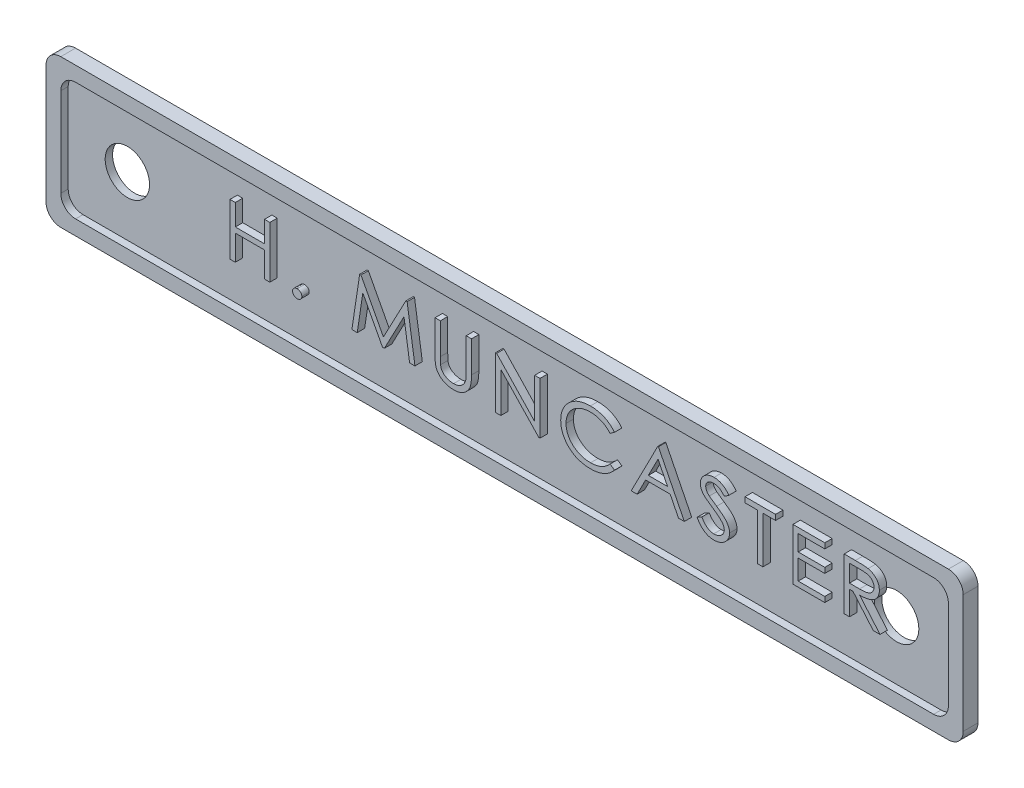
from build123d import *

# Parameters (mm, degrees)
BOSS_EXTRUDE1_DEPTH     = 1
CUT_EXTRUDE1_DEPTH      = 32.416556145
CUT_EXTRUDE1_DEPTH_BACK = 0.5
CUT_EXTRUDE2_DEPTH      = 32.416556145
CUT_EXTRUDE2_DEPTH_BACK = 32.416556145
SKETCH3_R               = 1.5
BOSS_EXTRUDE2_DEPTH     = 0.5


# Read off the part's stored shape, not the designer's step: Boss-Extrude2
with BuildPart() as part:
    # Sketch1 → Boss-Extrude1 (new body)
    with BuildSketch(Plane.XY):
        with BuildLine():
            Line((-30, -5), (30, -5))
            ThreePointArc((30, -5), (30.707106781, -4.707106781), (31, -4))
            Line((31, -4), (31, 4))
            ThreePointArc((31, 4), (30.707106781, 4.707106781), (30, 5))
            Line((30, 5), (-30, 5))
            ThreePointArc((-30, 5), (-30.707106781, 4.707106781), (-31, 4))
            Line((-31, 4), (-31, -4))
            ThreePointArc((-31, -4), (-30.707106781, -4.707106781), (-30, -5))
        make_face()
    extrude(amount=-BOSS_EXTRUDE1_DEPTH)

    # Sketch2 → Cut-Extrude1 (cut, two sides: drawn at the far end of the back side and taken through both)
    with BuildSketch(Plane.XY.offset(-CUT_EXTRUDE1_DEPTH_BACK)):
        with BuildLine():
            Line((-29, 4), (29, 4))
            ThreePointArc((29, 4), (29.707106781, 3.707106781), (30, 3))
            Line((30, 3), (30, -3))
            ThreePointArc((30, -3), (29.707106781, -3.707106781), (29, -4))
            Line((29, -4), (-29, -4))
            ThreePointArc((-29, -4), (-29.707106781, -3.707106781), (-30, -3))
            Line((-30, -3), (-30, 3))
            ThreePointArc((-30, 3), (-29.707106781, 3.707106781), (-29, 4))
        make_face()
    extrude(amount=CUT_EXTRUDE1_DEPTH + CUT_EXTRUDE1_DEPTH_BACK, mode=Mode.SUBTRACT)

    # Sketch3 → Cut-Extrude2 (cut, two sides: drawn at the far end of the back side and taken through both)
    with BuildSketch(Plane.XY.offset(-CUT_EXTRUDE2_DEPTH_BACK)):
        with Locations((-26, 0)):
            Circle(SKETCH3_R)
        with Locations((26, 0)):
            Circle(SKETCH3_R)
    extrude(amount=CUT_EXTRUDE2_DEPTH + CUT_EXTRUDE2_DEPTH_BACK, mode=Mode.SUBTRACT)

    # Boss-Extrude2 outline → Boss-Extrude2 (add)
    # profile 1 of 11: a face of its own
    with BuildSketch(Plane.XY.offset(-0.5)):
        with BuildLine():
            add(Edge.make_bspline(
                [(25.331789326, 1.42604884), (25.33144577, 1.402426709), (25.330767279, 1.355775232), (25.323553479, 1.286869141), (25.311696069, 1.220342524), (25.295212367, 1.156025841), (25.275565465, 1.093459874), (25.248777369, 1.033708049), (25.219053836, 0.975596543), (25.172971726, 0.901335826), (25.104081894, 0.815663446), (25.005342026, 0.725416168), (24.890178633, 0.649457557), (24.782551932, 0.597584892), (24.687441161, 0.563920272), (24.608977068, 0.54043691), (24.523526029, 0.5220622), (24.431893003, 0.505802679), (24.333607357, 0.493375206), (24.228826773, 0.484354701), (24.117507422, 0.478714503), (24.041030877, 0.477866492), (24.001761281, 0.477431051)],
                knots=[0, 0, 0, 0, 0.038286397, 0.075612016, 0.112179893, 0.147744628, 0.183212346, 0.218338395, 0.253757505, 0.288981512, 0.35987342, 0.431214511, 0.504987446, 0.582774945, 0.624243966, 0.668485211, 0.715460403, 0.765856342, 0.819339851, 0.876011339, 0.936333622, 1, 1, 1, 1], degree=3))
            add(Edge.make_bspline(
                [(24.568968813, 2.314370154), (24.596674275, 2.30806279), (24.651273963, 2.295632746), (24.730040668, 2.269073048), (24.80511746, 2.238433638), (24.876409994, 2.202733394), (24.943149357, 2.160919698), (25.006368689, 2.114740718), (25.065737568, 2.063390816), (25.119822707, 2.006595013), (25.170155663, 1.94652931), (25.213390147, 1.882036331), (25.250327495, 1.814324863), (25.27973483, 1.742983969), (25.302790942, 1.66856425), (25.319932563, 1.59076033), (25.329621406, 1.509494837), (25.331060083, 1.454118319), (25.331789326, 1.42604884)],
                knots=[0, 0, 0, 0, 0.066872612, 0.131787147, 0.195458011, 0.257726808, 0.319271524, 0.380693086, 0.441939345, 0.50382514, 0.565199839, 0.626255411, 0.686340912, 0.746539722, 0.807637445, 0.869599052, 0.933901825, 1, 1, 1, 1], degree=3))
            add(Edge.make_bspline(
                [(23.710795736, 2.362046436), (23.761509924, 2.361891951), (23.858736382, 2.361595782), (23.998057394, 2.359919705), (24.124468825, 2.355162204), (24.238129814, 2.351043281), (24.339051146, 2.343516076), (24.427289451, 2.336492171), (24.502649927, 2.326927211), (24.548201091, 2.318302389), (24.568968813, 2.314370154)],
                knots=[0, 0, 0, 0, 0.176792471, 0.338936828, 0.485664851, 0.617769923, 0.735369726, 0.838412773, 0.926329025, 1, 1, 1, 1], degree=3))
            Line((23.710795736, 2.362046436), (22.953584198, 2.362046436))
            Line((22.953584198, 2.362046436), (22.953584198, -1.137953564))
            Line((22.953584198, -1.137953564), (23.312558557, -1.137953564))
            Line((23.312558557, -1.137953564), (23.312558557, 0.477431051))
            Line((23.312558557, 0.477431051), (23.545330993, 0.477431051))
            Line((23.545330993, 0.477431051), (24.920230833, -1.137953564))
            Line((24.920230833, -1.137953564), (25.376661121, -1.137953564))
            Line((25.376661121, -1.137953564), (24.001761281, 0.477431051))
        make_face()
        with BuildLine():
            add(Edge.make_bspline(
                [(23.989842211, 0.831497558), (24.02163156, 0.831483625), (24.083128745, 0.831456672), (24.171938527, 0.835436582), (24.25449268, 0.840017294), (24.330510081, 0.846909076), (24.400226371, 0.855943476), (24.463428912, 0.867037126), (24.520362266, 0.880202185), (24.586747928, 0.900289751), (24.660927982, 0.932218463), (24.741538379, 0.978635524), (24.810065279, 1.037437383), (24.86873104, 1.103905839), (24.914761041, 1.178055018), (24.948218385, 1.257264055), (24.96962039, 1.340554612), (24.971744851, 1.39787634), (24.972814967, 1.426749961)],
                knots=[0, 0, 0, 0, 0.073424095, 0.142040506, 0.205318064, 0.264410853, 0.318316658, 0.367666659, 0.412582936, 0.453227538, 0.527731342, 0.598653703, 0.667225499, 0.735330284, 0.802742541, 0.867818528, 0.933418655, 1, 1, 1, 1], degree=3))
            Line((23.989842211, 0.831497558), (23.312558557, 0.83640541))
            Line((23.312558557, 0.83640541), (23.312558557, 2.003072077))
            Line((23.312558557, 2.003072077), (24.005968012, 2.003072077))
            add(Edge.make_bspline(
                [(24.972814967, 1.426749961), (24.971370651, 1.454902425), (24.968506682, 1.510726595), (24.948430464, 1.592493569), (24.914170068, 1.669870833), (24.866727295, 1.741582204), (24.810031622, 1.807676), (24.742411848, 1.863149596), (24.667394952, 1.909440523), (24.597654287, 1.938847474), (24.535265677, 1.957222935), (24.480948809, 1.969625267), (24.419396819, 1.980162942), (24.350557273, 1.988184941), (24.274599171, 1.995292544), (24.191349943, 2.000055009), (24.101107106, 2.002863026), (24.038455551, 2.003000691), (24.005968012, 2.003072077)],
                knots=[0, 0, 0, 0, 0.066371867, 0.131610311, 0.197257284, 0.264983957, 0.333739042, 0.40184148, 0.470377491, 0.541015671, 0.579555523, 0.623678142, 0.672339053, 0.726758959, 0.787090798, 0.852245365, 0.923382836, 1, 1, 1, 1], degree=3))
        make_face(mode=Mode.SUBTRACT)
    # profile 2 of 11: a face of its own
    with BuildSketch(Plane.XY.offset(-0.5)):
        with BuildLine():
            add(Edge.make_bspline(
                [(14.143708397, -1.227697154), (14.115403602, -1.227203282), (14.059601152, -1.226229622), (13.977002615, -1.217127876), (13.89620805, -1.204490854), (13.817683654, -1.184317858), (13.740762519, -1.159838533), (13.665864432, -1.12989167), (13.593209588, -1.093599389), (13.522150859, -1.052390006), (13.452761098, -1.004087581), (13.385002283, -0.948812861), (13.318719817, -0.885970096), (13.254475201, -0.815407337), (13.19039256, -0.738289713), (13.128247367, -0.653464045), (13.067719476, -0.561067958), (13.029582909, -0.496128671), (13.009994454, -0.462773276)],
                knots=[0, 0, 0, 0, 0.058847856, 0.116017606, 0.172674649, 0.228791152, 0.284438335, 0.340491645, 0.396359181, 0.453216044, 0.511196287, 0.572004925, 0.634927463, 0.700977186, 0.770371014, 0.843383461, 0.919555531, 1, 1, 1, 1], degree=3))
            add(Edge.make_bspline(
                [(15.208712403, -0.280481609), (15.207807786, -0.311862478), (15.206015389, -0.37404014), (15.190539439, -0.465390526), (15.167093736, -0.554082644), (15.13197973, -0.639061407), (15.088608944, -0.721589531), (15.034825327, -0.800464366), (14.971084763, -0.875776161), (14.898965391, -0.946987439), (14.820207349, -1.012857307), (14.736070168, -1.070223869), (14.647798082, -1.119359077), (14.554940755, -1.158254846), (14.458121233, -1.189526896), (14.35720182, -1.211759523), (14.251831986, -1.225574186), (14.180210112, -1.226980456), (14.143708397, -1.227697154)],
                knots=[0, 0, 0, 0, 0.059474724, 0.117842472, 0.17526004, 0.233122401, 0.291812385, 0.351805112, 0.413777488, 0.478655314, 0.543805102, 0.608225581, 0.671510741, 0.735065405, 0.798843786, 0.864226857, 0.930803926, 1, 1, 1, 1], degree=3))
            add(Edge.make_bspline(
                [(14.335114647, 0.849025602), (14.375477316, 0.82144876), (14.453396585, 0.768212255), (14.563842546, 0.68711917), (14.664916203, 0.608930282), (14.755934236, 0.532729617), (14.837124664, 0.459051804), (14.9080745, 0.387271354), (14.970260913, 0.318434862), (15.021859956, 0.250193252), (15.06582341, 0.183501101), (15.103872969, 0.117524179), (15.136236588, 0.051481161), (15.163120224, -0.014448866), (15.18386449, -0.080786909), (15.197213161, -0.147362151), (15.207367785, -0.213802189), (15.208263899, -0.258240361), (15.208712403, -0.280481609)],
                knots=[0, 0, 0, 0, 0.098626432, 0.190396213, 0.276420438, 0.356418976, 0.429850913, 0.497539495, 0.560000044, 0.616870403, 0.669969696, 0.721089008, 0.770437721, 0.818248483, 0.864635824, 0.910415192, 0.955162918, 1, 1, 1, 1], degree=3))
            add(Edge.make_bspline(
                [(13.837318172, 1.197483135), (13.845442595, 1.190636517), (13.864792261, 1.174330156), (13.900118502, 1.1479888), (13.946268003, 1.114718871), (14.003144942, 1.074636462), (14.070634785, 1.027243914), (14.149358241, 0.974351786), (14.238426009, 0.91374824), (14.301664365, 0.871416966), (14.335114647, 0.849025602)],
                knots=[0, 0, 0, 0, 0.05242958, 0.124869786, 0.217393222, 0.333247949, 0.468284315, 0.624409857, 0.801329493, 1, 1, 1, 1], degree=3))
            add(Edge.make_bspline(
                [(13.593327788, 1.649706692), (13.594047127, 1.630966394), (13.595486478, 1.593468305), (13.605786614, 1.537749049), (13.621837069, 1.482600532), (13.645525964, 1.42772144), (13.677682614, 1.371815843), (13.72124318, 1.315280933), (13.774912437, 1.256181157), (13.815760638, 1.217759871), (13.837318172, 1.197483135)],
                knots=[0, 0, 0, 0, 0.105914595, 0.211928052, 0.319381041, 0.430075511, 0.549063436, 0.68304901, 0.832729921, 1, 1, 1, 1], degree=3))
            add(Edge.make_bspline(
                [(14.135294935, 2.092815667), (14.0970436, 2.091610002), (14.023411819, 2.089289162), (13.91886913, 2.063845258), (13.824851488, 2.023848373), (13.756711755, 1.976303887), (13.709002563, 1.932918563), (13.678613472, 1.897657801), (13.651425658, 1.861735009), (13.63065402, 1.822411743), (13.613258275, 1.782045522), (13.60271647, 1.739106157), (13.594066594, 1.695156236), (13.593575473, 1.664943657), (13.593327788, 1.649706692)],
                knots=[0, 0, 0, 0, 0.146686048, 0.282362824, 0.410636052, 0.537156407, 0.599427582, 0.657961687, 0.715789117, 0.772040649, 0.828399565, 0.884154463, 0.94157618, 1, 1, 1, 1], degree=3))
            add(Edge.make_bspline(
                [(14.856749262, 1.688969513), (14.838605851, 1.708680114), (14.803449185, 1.746873542), (14.751108622, 1.800922103), (14.700343244, 1.849275788), (14.65229842, 1.893255365), (14.605108071, 1.93059437), (14.561135802, 1.964359681), (14.518290634, 1.991306503), (14.465112643, 2.021658418), (14.397338223, 2.050177609), (14.313180358, 2.07499781), (14.225342047, 2.090035284), (14.165500652, 2.091883005), (14.135294935, 2.092815667)],
                knots=[0, 0, 0, 0, 0.09387455, 0.181901644, 0.263569768, 0.339536882, 0.410008252, 0.474376863, 0.533669217, 0.587201607, 0.688819045, 0.790400177, 0.894201782, 1, 1, 1, 1], degree=3))
            Line((14.856749262, 1.688969513), (15.163840608, 1.904213904))
            add(Edge.make_bspline(
                [(14.161236442, 2.451790026), (14.205507298, 2.450580815), (14.293463654, 2.448178383), (14.422582099, 2.424729007), (14.547535633, 2.388132094), (14.647939446, 2.34516266), (14.727081589, 2.302784571), (14.786948305, 2.263562484), (14.847726748, 2.21848468), (14.910265893, 2.168338854), (14.972662761, 2.11109282), (15.035774179, 2.047674626), (15.100168121, 1.978523714), (15.142280893, 1.929375451), (15.163840608, 1.904213904)],
                knots=[0, 0, 0, 0, 0.111965164, 0.222449906, 0.331017474, 0.441010147, 0.498185751, 0.558078741, 0.621972206, 0.689694644, 0.760886176, 0.836182118, 0.91613312, 1, 1, 1, 1], degree=3))
            add(Edge.make_bspline(
                [(13.234353429, 1.634983135), (13.235858925, 1.672021896), (13.238840919, 1.745386029), (13.261952609, 1.852653208), (13.299528808, 1.954813354), (13.351434669, 2.051120841), (13.417832506, 2.139662799), (13.496421151, 2.219240774), (13.587968506, 2.287895057), (13.689657185, 2.346368512), (13.800260806, 2.39280488), (13.916179408, 2.427811972), (14.03740464, 2.447479384), (14.119569379, 2.450339576), (14.161236442, 2.451790026)],
                knots=[0, 0, 0, 0, 0.080663004, 0.159772388, 0.237920175, 0.317221133, 0.397282184, 0.478310936, 0.560104337, 0.645889526, 0.733293687, 0.820954168, 0.909202976, 1, 1, 1, 1], degree=3))
            add(Edge.make_bspline(
                [(13.441184358, 1.10213057), (13.424737862, 1.122693339), (13.392494444, 1.163006724), (13.350348436, 1.226565114), (13.313868239, 1.291148051), (13.285915358, 1.357889794), (13.261759356, 1.424961708), (13.245820704, 1.493899943), (13.236734325, 1.564159388), (13.2351478, 1.611353236), (13.234353429, 1.634983135)],
                knots=[0, 0, 0, 0, 0.135250219, 0.26515856, 0.391492433, 0.51575998, 0.636542915, 0.757439247, 0.878550146, 1, 1, 1, 1], degree=3))
            add(Edge.make_bspline(
                [(14.048355833, 0.626068872), (14.009417676, 0.652272653), (13.935022529, 0.702337532), (13.830941851, 0.777093355), (13.737347972, 0.844577954), (13.655869573, 0.907437846), (13.585273972, 0.963454061), (13.526366602, 1.014230663), (13.47921031, 1.059350744), (13.452948206, 1.088896046), (13.441184358, 1.10213057)],
                knots=[0, 0, 0, 0, 0.182070466, 0.347863382, 0.497115649, 0.629679678, 0.747065389, 0.846688458, 0.931325621, 1, 1, 1, 1], degree=3))
            add(Edge.make_bspline(
                [(14.717226025, 0.067975923), (14.700637452, 0.08805014), (14.665721953, 0.130302193), (14.605576168, 0.192642853), (14.535743992, 0.257757762), (14.456890311, 0.326292011), (14.36792156, 0.396882022), (14.270549237, 0.471441062), (14.163173089, 0.548516228), (14.087516702, 0.599617892), (14.048355833, 0.626068872)],
                knots=[0, 0, 0, 0, 0.089345299, 0.188053285, 0.29699683, 0.416964832, 0.546483428, 0.686686869, 0.837824474, 1, 1, 1, 1], degree=3))
            add(Edge.make_bspline(
                [(14.849738044, -0.275573756), (14.848005388, -0.246432946), (14.844480749, -0.187153548), (14.818709536, -0.099447667), (14.776444721, -0.012874089), (14.737524146, 0.040263334), (14.717226025, 0.067975923)],
                knots=[0, 0, 0, 0, 0.232957253, 0.473890927, 0.725620037, 1, 1, 1, 1], degree=3))
            add(Edge.make_bspline(
                [(14.13319157, -0.868722795), (14.165276301, -0.867862919), (14.228891106, -0.866158032), (14.322431799, -0.849992631), (14.413109161, -0.8248983), (14.499226144, -0.789100994), (14.579705142, -0.745690842), (14.650777381, -0.693851979), (14.71146759, -0.634817444), (14.761272424, -0.569450625), (14.800531782, -0.499481438), (14.828760177, -0.426794768), (14.846620155, -0.351919525), (14.848693698, -0.301145984), (14.849738044, -0.275573756)],
                knots=[0, 0, 0, 0, 0.093111179, 0.184612719, 0.274864592, 0.365871363, 0.454874139, 0.539859979, 0.620498054, 0.699915665, 0.777709765, 0.852708708, 0.925816355, 1, 1, 1, 1], degree=3))
            add(Edge.make_bspline(
                [(13.330407115, -0.285389462), (13.358993154, -0.331548446), (13.413982827, -0.420342396), (13.507054139, -0.538991213), (13.602366732, -0.640267345), (13.701069454, -0.723837643), (13.8040504, -0.788349386), (13.910494455, -0.834747739), (14.02067023, -0.863533282), (14.095630164, -0.866990453), (14.13319157, -0.868722795)],
                knots=[0, 0, 0, 0, 0.156627694, 0.301297613, 0.434433764, 0.557523125, 0.673586178, 0.783874365, 0.891702377, 1, 1, 1, 1], degree=3))
            Line((13.330407115, -0.285389462), (13.009994454, -0.462773276))
        make_face()
    # profile 3 of 11: a face of its own
    with BuildSketch(Plane.XY.offset(-0.5)):
        with BuildLine():
            add(Edge.make_bspline(
                [(5.799938365, 2.451790026), (5.842722913, 2.451310074), (5.927457029, 2.450359537), (6.053135577, 2.440989804), (6.175726748, 2.425582898), (6.295055606, 2.404498406), (6.411370468, 2.378188385), (6.524019961, 2.344239611), (6.633751233, 2.304860566), (6.740196418, 2.260296534), (6.842536172, 2.20957993), (6.940819703, 2.154437267), (7.033970061, 2.093884565), (7.123005604, 2.029493009), (7.206123027, 1.959108665), (7.285272032, 1.884468716), (7.35952587, 1.80482672), (7.405142271, 1.748148775), (7.427943172, 1.719818872)],
                knots=[0, 0, 0, 0, 0.069378727, 0.137403465, 0.204255485, 0.269685896, 0.333862656, 0.39754052, 0.460363228, 0.522874159, 0.584575479, 0.645504776, 0.705536189, 0.764669447, 0.823584865, 0.882033913, 0.941035833, 1, 1, 1, 1], degree=3))
            add(Edge.make_bspline(
                [(3.793327788, 0.632378968), (3.795084712, 0.695339076), (3.798542909, 0.819265034), (3.825725917, 1.001242739), (3.870757804, 1.175317467), (3.933245515, 1.342019845), (4.014880532, 1.500529584), (4.113099598, 1.652151758), (4.230938385, 1.794818206), (4.363901615, 1.92943771), (4.510661238, 2.051727213), (4.667829367, 2.159521768), (4.834992486, 2.248943027), (5.010178277, 2.324075972), (5.194875891, 2.381621249), (5.388608737, 2.421852652), (5.591275879, 2.447054225), (5.729517682, 2.450191759), (5.799938365, 2.451790026)],
                knots=[0, 0, 0, 0, 0.062456062, 0.122933832, 0.182106742, 0.240599535, 0.299199345, 0.358698555, 0.419511983, 0.48248259, 0.5462033, 0.608789684, 0.671255649, 0.734015374, 0.797681622, 0.862859328, 0.930140236, 1, 1, 1, 1], degree=3))
            add(Edge.make_bspline(
                [(4.265883877, -0.615617827), (4.228054082, -0.572160181), (4.153123068, -0.486081857), (4.057453218, -0.345501026), (3.975062129, -0.199267793), (3.909453581, -0.045443622), (3.857017217, 0.114437236), (3.819950914, 0.281122908), (3.797944078, 0.454638412), (3.794883328, 0.572486161), (3.793327788, 0.632378968)],
                knots=[0, 0, 0, 0, 0.126375425, 0.250316938, 0.372494108, 0.494282934, 0.61676667, 0.741352018, 0.868549432, 1, 1, 1, 1], degree=3))
            add(Edge.make_bspline(
                [(5.805547339, -1.227697154), (5.765333722, -1.227439466), (5.685996831, -1.226931076), (5.568858076, -1.218515643), (5.454868185, -1.20707338), (5.344088059, -1.189814121), (5.236185183, -1.169577952), (5.132091575, -1.142214037), (5.030851271, -1.111661147), (4.932743545, -1.075928451), (4.837911207, -1.0352594), (4.746454245, -0.989467166), (4.658282259, -0.939033331), (4.57302635, -0.884130085), (4.490952157, -0.824621769), (4.412340996, -0.759950524), (4.336966663, -0.690398331), (4.289686941, -0.640659123), (4.265883877, -0.615617827)],
                knots=[0, 0, 0, 0, 0.070622674, 0.139330502, 0.206202275, 0.271810776, 0.336221533, 0.39895142, 0.46076652, 0.521936161, 0.582256799, 0.641925698, 0.701502727, 0.760604013, 0.819974173, 0.879477605, 0.939322778, 1, 1, 1, 1], degree=3))
            add(Edge.make_bspline(
                [(7.427943172, -0.493622635), (7.404449926, -0.522202897), (7.357434839, -0.579398206), (7.281020182, -0.659415373), (7.200822448, -0.735174511), (7.115564218, -0.805022367), (7.026867745, -0.871236505), (6.933169606, -0.931468862), (6.835579555, -0.986967336), (6.734025382, -1.037364774), (6.62882661, -1.082473185), (6.51999147, -1.120755463), (6.408366908, -1.153749075), (6.29377569, -1.181328726), (6.175997927, -1.20229148), (6.055190584, -1.216675861), (5.931439627, -1.226343456), (5.847867109, -1.227242097), (5.805547339, -1.227697154)],
                knots=[0, 0, 0, 0, 0.060159729, 0.120392676, 0.179827417, 0.239499956, 0.299563525, 0.359771276, 0.420548767, 0.482090621, 0.544085172, 0.606606614, 0.669634497, 0.733346495, 0.798220522, 0.864090401, 0.931177578, 1, 1, 1, 1], degree=3))
            Line((7.427943172, -0.493622635), (7.129966409, -0.285389462))
            add(Edge.make_bspline(
                [(5.811156313, -0.868722795), (5.875525403, -0.867029298), (6.002289781, -0.863694234), (6.188187352, -0.835603015), (6.366154734, -0.79008616), (6.536132183, -0.725850279), (6.69823858, -0.643494047), (6.851734141, -0.542344284), (6.997508677, -0.42343408), (7.085310823, -0.331928559), (7.129966409, -0.285389462)],
                knots=[0, 0, 0, 0, 0.129799545, 0.255618941, 0.378318524, 0.49977355, 0.621436125, 0.744356528, 0.869981436, 1, 1, 1, 1], degree=3))
            add(Edge.make_bspline(
                [(4.152302147, 0.608540827), (4.153449201, 0.556796173), (4.155702798, 0.455134411), (4.179431474, 0.30631858), (4.215035688, 0.163722496), (4.268067524, 0.028272175), (4.333774519, -0.101393372), (4.415267766, -0.224336589), (4.511843023, -0.340008006), (4.621569835, -0.448164556), (4.742365975, -0.546670024), (4.872059304, -0.633154375), (5.010119535, -0.705828044), (5.155441689, -0.765419497), (5.308489959, -0.811981395), (5.469322737, -0.844437937), (5.637646089, -0.865641743), (5.752663614, -0.86768413), (5.811156313, -0.868722795)],
                knots=[0, 0, 0, 0, 0.062485776, 0.122764647, 0.181680112, 0.239799385, 0.298159751, 0.357070476, 0.417645744, 0.47996084, 0.542998926, 0.605747799, 0.668037285, 0.731242206, 0.795306543, 0.861059661, 0.929341242, 1, 1, 1, 1], degree=3))
            add(Edge.make_bspline(
                [(5.788019294, 2.092815667), (5.750834636, 2.092412775), (5.677031881, 2.09161313), (5.567765237, 2.081079628), (5.460508121, 2.065897665), (5.355335463, 2.044209093), (5.252245159, 2.015851547), (5.150764231, 1.982595946), (5.052082999, 1.941399019), (4.955417671, 1.895519804), (4.862760027, 1.84386908), (4.77488877, 1.787768129), (4.692627927, 1.72740513), (4.61592158, 1.662610737), (4.544354433, 1.593690599), (4.477190262, 1.521081391), (4.417395259, 1.442645747), (4.361597388, 1.361667096), (4.312624686, 1.276678857), (4.269961286, 1.188989432), (4.232858148, 1.098826855), (4.203927966, 1.005525098), (4.180396629, 0.910074383), (4.164504803, 0.811821827), (4.154428466, 0.711115337), (4.153014806, 0.64291979), (4.152302147, 0.608540827)],
                knots=[0, 0, 0, 0, 0.045279497, 0.089869096, 0.133592367, 0.177197774, 0.220568361, 0.263780755, 0.307184966, 0.350733648, 0.394063104, 0.436312942, 0.477651363, 0.518257898, 0.55852672, 0.598627135, 0.638602046, 0.678556678, 0.718352774, 0.75794981, 0.797281925, 0.836988313, 0.876829189, 0.916938697, 0.958126863, 1, 1, 1, 1], degree=3))
            add(Edge.make_bspline(
                [(7.129966409, 1.509482333), (7.109444113, 1.532876091), (7.068537208, 1.579506655), (7.002359604, 1.644717318), (6.932934536, 1.705341383), (6.861446064, 1.762775635), (6.785999109, 1.814620072), (6.707501264, 1.862226248), (6.62605059, 1.905766498), (6.541772444, 1.945033517), (6.455021978, 1.980121901), (6.366029001, 2.010199772), (6.274935318, 2.035477822), (6.181868315, 2.056663623), (6.086302586, 2.072512455), (5.988792582, 2.08459988), (5.889090049, 2.09176941), (5.8219183, 2.092464753), (5.788019294, 2.092815667)],
                knots=[0, 0, 0, 0, 0.061749288, 0.123084294, 0.184217265, 0.244633342, 0.304978153, 0.365754619, 0.426764285, 0.488188676, 0.550205677, 0.612399361, 0.674522085, 0.737763796, 0.801742866, 0.866698135, 0.932727661, 1, 1, 1, 1], degree=3))
            Line((7.129966409, 1.509482333), (7.427943172, 1.719818872))
        make_face()
    # profile 4 of 11: a face of its own
    with BuildSketch(Plane.XY.offset(-0.5)):
        with BuildLine():
            add(Edge.make_bspline(
                [(-4.636680225, -0.489415904), (-4.642342999, -0.470793544), (-4.654610192, -0.430452171), (-4.667903337, -0.363519843), (-4.679944277, -0.286600281), (-4.688415771, -0.199237294), (-4.69626794, -0.102025322), (-4.701924428, 0.005516333), (-4.704259353, 0.123354467), (-4.705002664, 0.205395351), (-4.705390161, 0.248164224)],
                knots=[0, 0, 0, 0, 0.078528093, 0.17011438, 0.275118877, 0.392739949, 0.524280677, 0.668816025, 0.827349915, 1, 1, 1, 1], degree=3))
            add(Edge.make_bspline(
                [(-3.433555225, -1.227697154), (-3.470494244, -1.226906647), (-3.543081423, -1.225353257), (-3.649978897, -1.216597913), (-3.752619993, -1.199896111), (-3.851771301, -1.178896367), (-3.946377028, -1.149550441), (-4.03750394, -1.115713618), (-4.123735661, -1.073628472), (-4.206405072, -1.027272134), (-4.283227927, -0.974804577), (-4.35373448, -0.917743432), (-4.417832694, -0.856596747), (-4.475303535, -0.791399553), (-4.526578474, -0.72229163), (-4.56958, -0.648317592), (-4.607497776, -0.570938194), (-4.62690119, -0.516734013), (-4.636680225, -0.489415904)],
                knots=[0, 0, 0, 0, 0.073340365, 0.144117799, 0.212689457, 0.279668405, 0.345126088, 0.40914745, 0.472438429, 0.535393527, 0.597161272, 0.656866437, 0.715275907, 0.772799756, 0.829218492, 0.885791531, 0.942440614, 1, 1, 1, 1], degree=3))
            add(Edge.make_bspline(
                [(-2.237441443, 0.248164224), (-2.237627754, 0.210063262), (-2.237991398, 0.135697125), (-2.243235865, 0.02675536), (-2.250678366, -0.076610861), (-2.261266965, -0.174347642), (-2.274188682, -0.266380004), (-2.291347013, -0.352833726), (-2.310407055, -0.434013251), (-2.333851098, -0.509884324), (-2.361163806, -0.58195548), (-2.395313671, -0.650584225), (-2.434184202, -0.717819904), (-2.481415974, -0.781393396), (-2.532639348, -0.843893037), (-2.591166827, -0.903298787), (-2.655369671, -0.960394015), (-2.725028482, -1.015028822), (-2.799741465, -1.064610679), (-2.878687226, -1.108356212), (-2.961599314, -1.145709204), (-3.048696809, -1.17580434), (-3.139537439, -1.198754146), (-3.233905293, -1.215803419), (-3.332387228, -1.225571254), (-3.39941286, -1.226979701), (-3.433555225, -1.227697154)],
                knots=[0, 0, 0, 0, 0.052724765, 0.102909136, 0.15091036, 0.196129604, 0.238943643, 0.27947707, 0.318073697, 0.354290365, 0.389308677, 0.424603725, 0.460271745, 0.496631114, 0.534067864, 0.572035973, 0.611896648, 0.652916245, 0.694450333, 0.735855767, 0.777694763, 0.820144399, 0.863211806, 0.907242497, 0.952750008, 1, 1, 1, 1], degree=3))
            Line((-2.237441443, 0.248164224), (-2.237441443, 2.362046436))
            Line((-2.237441443, 2.362046436), (-2.596415802, 2.362046436))
            Line((-2.596415802, 2.362046436), (-2.596415802, 0.264991147))
            add(Edge.make_bspline(
                [(-2.634977501, -0.278378244), (-2.631733491, -0.266034987), (-2.624511951, -0.23855748), (-2.617622237, -0.192004681), (-2.610227077, -0.137154468), (-2.605943059, -0.073443162), (-2.601718964, -0.001233601), (-2.597905082, 0.079858262), (-2.597048736, 0.169637563), (-2.596632979, 0.232272771), (-2.596415802, 0.264991147)],
                knots=[0, 0, 0, 0, 0.070081025, 0.15600842, 0.258271055, 0.374199566, 0.506698057, 0.655805442, 0.820205164, 1, 1, 1, 1], degree=3))
            add(Edge.make_bspline(
                [(-3.453186635, -0.868722795), (-3.422064309, -0.867659609), (-3.360240969, -0.865547631), (-3.268450163, -0.852244786), (-3.179231394, -0.828507501), (-3.092163188, -0.79757111), (-3.010387553, -0.756724262), (-2.933661387, -0.710215838), (-2.865619862, -0.654526873), (-2.803289346, -0.593711398), (-2.748730228, -0.525008183), (-2.702990188, -0.449045614), (-2.66328693, -0.366892091), (-2.644557185, -0.308330621), (-2.634977501, -0.278378244)],
                knots=[0, 0, 0, 0, 0.086053374, 0.170941815, 0.255724454, 0.340956455, 0.425911262, 0.508029983, 0.588453552, 0.668408569, 0.748428827, 0.830208776, 0.913157051, 1, 1, 1, 1], degree=3))
            add(Edge.make_bspline(
                [(-4.330991123, -0.200553724), (-4.325423965, -0.233435455), (-4.314583297, -0.297464525), (-4.286429629, -0.388204386), (-4.248990434, -0.470816034), (-4.201686055, -0.545714011), (-4.141624036, -0.613112228), (-4.068818084, -0.674450809), (-3.981309162, -0.728571564), (-3.883447449, -0.777766479), (-3.778010204, -0.817367002), (-3.670190559, -0.847316146), (-3.561783453, -0.865563057), (-3.489244625, -0.86767365), (-3.453186635, -0.868722795)],
                knots=[0, 0, 0, 0, 0.082565468, 0.160775914, 0.234628801, 0.306756542, 0.379373118, 0.457448387, 0.541789919, 0.633725535, 0.72847766, 0.820354898, 0.910701047, 1, 1, 1, 1], degree=3))
            add(Edge.make_bspline(
                [(-4.346415802, 0.264991147), (-4.346471942, 0.235310172), (-4.346578478, 0.178985405), (-4.345866859, 0.098820146), (-4.344588394, 0.027531396), (-4.342373934, -0.035096682), (-4.340155539, -0.088840151), (-4.338638173, -0.134021739), (-4.335022559, -0.170233918), (-4.33220227, -0.191444871), (-4.330991123, -0.200553724)],
                knots=[0, 0, 0, 0, 0.19104574, 0.362542215, 0.516010019, 0.649968505, 0.765887267, 0.862267999, 0.940852229, 1, 1, 1, 1], degree=3))
            Line((-4.346415802, 0.264991147), (-4.346415802, 2.362046436))
            Line((-4.346415802, 2.362046436), (-4.705390161, 2.362046436))
            Line((-4.705390161, 2.362046436), (-4.705390161, 0.248164224))
        make_face()
    # profile 5 of 11: a face of its own
    with BuildSketch(Plane.XY.offset(-0.5)):
        with BuildLine():
            add(Edge.make_bspline(
                [(-14.334877341, -0.891158692), (-14.333926531, -0.871382157), (-14.332063487, -0.832631425), (-14.313510148, -0.777359171), (-14.283935472, -0.727192108), (-14.24406576, -0.682751255), (-14.196078568, -0.645806922), (-14.142133337, -0.618625234), (-14.082888131, -0.602770446), (-14.041904442, -0.600607276), (-14.020774776, -0.599492026)],
                knots=[0, 0, 0, 0, 0.124198993, 0.243359213, 0.362764628, 0.488910772, 0.616974463, 0.742042599, 0.867006757, 1, 1, 1, 1], degree=3))
            add(Edge.make_bspline(
                [(-14.020774776, -1.182825359), (-14.041925551, -1.18178873), (-14.083012124, -1.17977502), (-14.142021345, -1.162790752), (-14.196064349, -1.135846041), (-14.244323084, -1.098847573), (-14.283719615, -1.053767346), (-14.313543201, -1.003583284), (-14.331903891, -0.948725), (-14.333880413, -0.910459325), (-14.334877341, -0.891158692)],
                knots=[0, 0, 0, 0, 0.133184738, 0.258718863, 0.383967083, 0.512215172, 0.639647468, 0.759224814, 0.878556611, 1, 1, 1, 1], degree=3))
            add(Edge.make_bspline(
                [(-13.706672212, -0.891158692), (-13.70766914, -0.910459325), (-13.709645661, -0.948725), (-13.728006352, -1.003583284), (-13.757829938, -1.053767346), (-13.797226469, -1.098847573), (-13.845485204, -1.135846041), (-13.899528208, -1.162790752), (-13.958537429, -1.17977502), (-13.999624002, -1.18178873), (-14.020774776, -1.182825359)],
                knots=[0, 0, 0, 0, 0.121443389, 0.240775186, 0.360352532, 0.487784828, 0.616032917, 0.741281137, 0.866815262, 1, 1, 1, 1], degree=3))
            add(Edge.make_bspline(
                [(-14.020774776, -0.599492026), (-13.999645111, -0.600607276), (-13.958661422, -0.602770446), (-13.899416216, -0.618625234), (-13.845470985, -0.645806922), (-13.797483793, -0.682751255), (-13.757614081, -0.727192108), (-13.728039405, -0.777359171), (-13.709486065, -0.832631425), (-13.707623021, -0.871382157), (-13.706672212, -0.891158692)],
                knots=[0, 0, 0, 0, 0.132993243, 0.257957401, 0.383025537, 0.511089228, 0.637235372, 0.756640787, 0.875801007, 1, 1, 1, 1], degree=3))
        make_face()
    # profile 6 of 11: a face of its own
    with BuildSketch(Plane.XY.offset(-0.5)):
        Polygon((19.489481634, 2.362046436), (19.489481634, -1.137953564), (21.643327788, -1.137953564), (21.643327788, -0.778979205), (19.848455993, -0.778979205), (19.848455993, 0.567174641), (21.643327788, 0.567174641), (21.643327788, 0.926149), (19.848455993, 0.926149), (19.848455993, 2.003072077), (21.643327788, 2.003072077), (21.643327788, 2.362046436), align=None)
    # profile 7 of 11: a face of its own
    with BuildSketch(Plane.XY.offset(-0.5)):
        Polygon((17.102302147, 2.003072077), (17.102302147, -1.137953564), (17.461276506, -1.137953564), (17.461276506, 2.003072077), (18.313840608, 2.003072077), (18.313840608, 2.362046436), (16.249738044, 2.362046436), (16.249738044, 2.003072077), align=None)
    # profile 8 of 11: a face of its own
    with BuildSketch(Plane.XY.offset(-0.5)):
        Polygon((10.353584198, 2.362046436), (8.558712403, -1.137953564), (8.956248461, -1.137953564), (9.531869454, -0.016158692), (11.192125865, -0.016158692), (11.753023301, -1.137953564), (12.148455993, -1.137953564), (10.398455993, 2.362046436), align=None)
        Polygon((9.715563365, 0.342815667), (10.372514486, 1.623064064), (11.013339807, 0.342815667), align=None, mode=Mode.SUBTRACT)
    # profile 9 of 11: a face of its own
    with BuildSketch(Plane.XY.offset(-0.5)):
        Polygon((-0.613082469, 2.362046436), (-0.613082469, -1.137953564), (-0.25410811, -1.137953564), (-0.25410811, 1.565572077), (2.311296538, -1.137953564), (2.393327788, -1.137953564), (2.393327788, 2.362046436), (2.034353429, 2.362046436), (2.034353429, -0.348490423), (-0.537361315, 2.362046436), align=None)
    # profile 10 of 11: a face of its own
    with BuildSketch(Plane.XY.offset(-0.5)):
        Polygon((-9.796796411, 2.362046436), (-10.323338879, -1.137953564), (-9.960858911, -1.137953564), (-9.582954264, 1.374866949), (-8.253627341, -1.137953564), (-8.126023174, -1.137953564), (-6.800902982, 1.374866949), (-6.420894969, -1.137953564), (-6.060518366, -1.137953564), (-6.589164199, 2.362046436), (-6.676804424, 2.362046436), (-8.191928623, -0.509748436), (-9.709857308, 2.362046436), align=None)
    # profile 11 of 11: a face of its own
    with BuildSketch(Plane.XY.offset(-0.5)):
        Polygon((-18.561800417, 2.362046436), (-18.561800417, -1.137953564), (-18.202826058, -1.137953564), (-18.202826058, 0.567174641), (-16.228467084, 0.567174641), (-16.228467084, -1.137953564), (-15.869492725, -1.137953564), (-15.869492725, 2.362046436), (-16.228467084, 2.362046436), (-16.228467084, 0.926149), (-18.202826058, 0.926149), (-18.202826058, 2.362046436), align=None)
    extrude(amount=BOSS_EXTRUDE2_DEPTH)


solid = part.part
